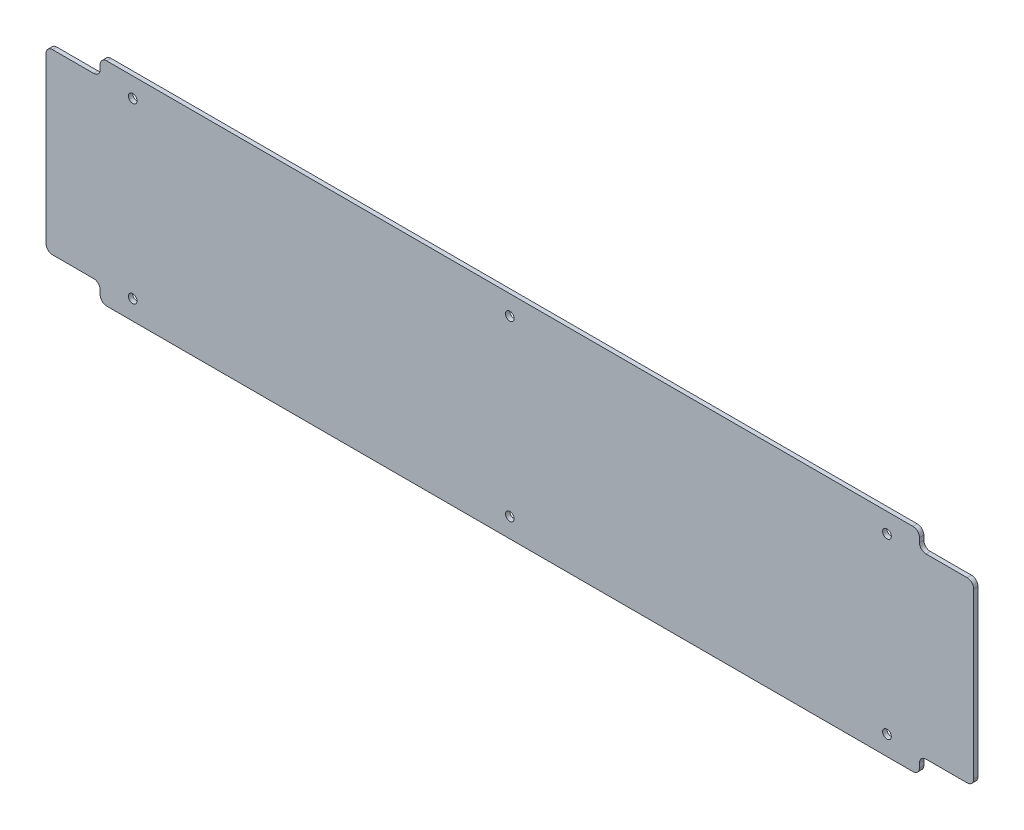
from build123d import *

# Parameters (mm, degrees)
BASE_FLANGE1_DEPTH    = 2
BREAK_CORNER1_START   = -2
BREAK_CORNER1_DEPTH   = 2
BREAK_CORNER1_2_DEPTH = 2
SKETCH2_R             = 2
CUT_EXTRUDE1_DEPTH    = 10
LPATTERN1_COUNT       = 3
LPATTERN1_PITCH       = 174


# Read off the part's stored shape, not the designer's step: Break-Corner1
# Sheet-metal steps are written as plain solids
with BuildPart() as part:
    # Sketch1 → Base-Flange1 (new body)
    with BuildSketch(Plane.XY):
        Polygon((189, -49), (-189, -49), (-189, -41), (-214, -41), (-214, 41), (-189, 41), (-189, 49), (189, 49), (189, 41), (214, 41), (214, -41), (189, -41), align=None)
    extrude(amount=-BASE_FLANGE1_DEPTH)

    # Break-Corner1 outline → Break-Corner1 (cut)
    with BuildSketch(Plane.XY.offset(BREAK_CORNER1_START)):
        with BuildLine():
            Line((214, 41), (211, 41))
            ThreePointArc((211, 41), (213.121320344, 40.121320344), (214, 38))
            Line((214, 38), (214, 41))
        make_face()
        with BuildLine():
            ThreePointArc((186, 49), (188.121320344, 48.121320344), (189, 46))
            Line((189, 46), (189, 49))
            Line((189, 49), (186, 49))
        make_face()
        with BuildLine():
            Line((214, -41), (214, -38))
            ThreePointArc((214, -38), (213.121320344, -40.121320344), (211, -41))
            Line((211, -41), (214, -41))
        make_face()
        with BuildLine():
            ThreePointArc((-189, 46), (-188.121320344, 48.121320344), (-186, 49))
            Line((-186, 49), (-189, 49))
            Line((-189, 49), (-189, 46))
        make_face()
        with BuildLine():
            Line((189, -49), (189, -46))
            ThreePointArc((189, -46), (188.121320344, -48.121320344), (186, -49))
            Line((186, -49), (189, -49))
        make_face()
        with BuildLine():
            ThreePointArc((-214, 38), (-213.121320344, 40.121320344), (-211, 41))
            Line((-211, 41), (-214, 41))
            Line((-214, 41), (-214, 38))
        make_face()
        with BuildLine():
            Line((-189, -49), (-186, -49))
            ThreePointArc((-186, -49), (-188.121320344, -48.121320344), (-189, -46))
            Line((-189, -46), (-189, -49))
        make_face()
        with BuildLine():
            ThreePointArc((-211, -41), (-213.121320344, -40.121320344), (-214, -38))
            Line((-214, -38), (-214, -41))
            Line((-214, -41), (-211, -41))
        make_face()
    extrude(amount=BREAK_CORNER1_DEPTH, mode=Mode.SUBTRACT)

    # Break-Corner1 2 outline → Break-Corner1 2 (add)
    with BuildSketch(Plane.XY.offset(BREAK_CORNER1_START)):
        with BuildLine():
            Line((189, 41), (192, 41))
            ThreePointArc((192, 41), (189.878679656, 41.878679656), (189, 44))
            Line((189, 44), (189, 41))
        make_face()
        with BuildLine():
            ThreePointArc((189, -44), (189.878679656, -41.878679656), (192, -41))
            Line((192, -41), (189, -41))
            Line((189, -41), (189, -44))
        make_face()
        with BuildLine():
            Line((-189, 41), (-189, 44))
            ThreePointArc((-189, 44), (-189.878679656, 41.878679656), (-192, 41))
            Line((-192, 41), (-189, 41))
        make_face()
        with BuildLine():
            ThreePointArc((-192, -41), (-189.878679656, -41.878679656), (-189, -44))
            Line((-189, -44), (-189, -41))
            Line((-189, -41), (-192, -41))
        make_face()
    extrude(amount=BREAK_CORNER1_2_DEPTH)

    # Sketch2 → Cut-Extrude1 (cut)
    with BuildSketch(Plane.XY):
        with Locations((-174, 40)):
            Circle(SKETCH2_R)
        with Locations((-174, -40)):
            Circle(SKETCH2_R)
    cut_extrude1 = extrude(amount=-CUT_EXTRUDE1_DEPTH, mode=Mode.SUBTRACT)

    # LPattern1: Cut-Extrude1 ×3
    with Locations(*[(i * LPATTERN1_PITCH, 0, 0) for i in range(1, LPATTERN1_COUNT)]):
        add(cut_extrude1, mode=Mode.SUBTRACT)


solid = part.part
